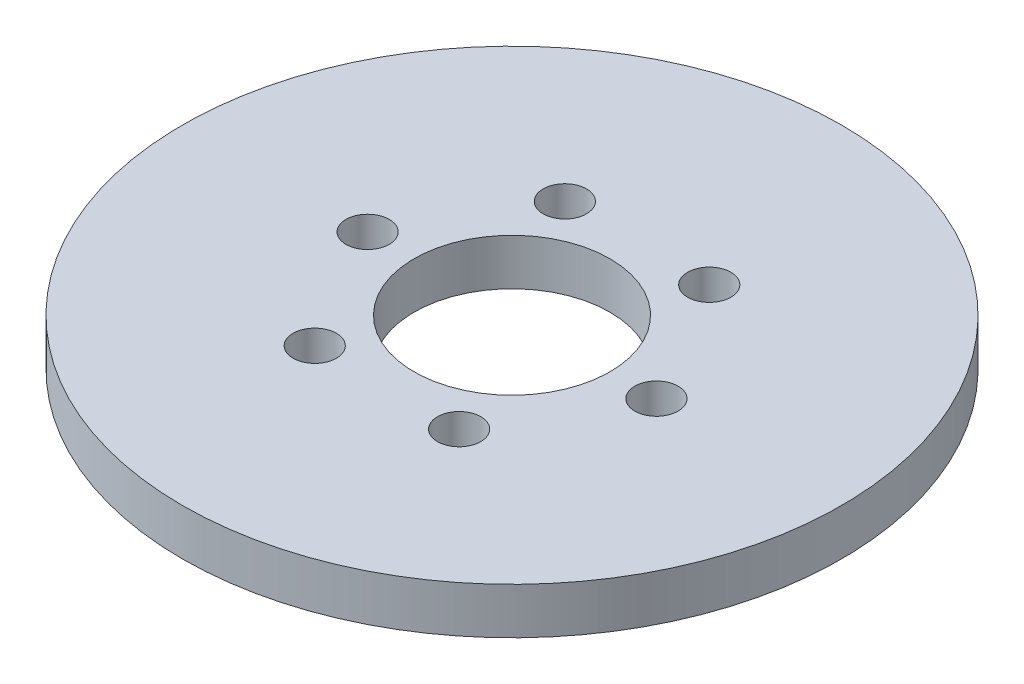
from build123d import *

# Parameters (mm, degrees)
SKETCH1_R           = 92.5
BOSS_EXTRUDE1_DEPTH = 13
SKETCH2_R           = 27.5
CUT_EXTRUDE1_DEPTH  = 132.459119121
SKETCH3_R           = 6.076508431
CUT_EXTRUDE2_DEPTH  = 10.455778892
CIRPATTERN1_COUNT   = 6


with BuildPart() as part:
    # Sketch1 → Boss-Extrude1 (new body)
    with BuildSketch(Plane(origin=(0, 0, 0), x_dir=(1, 0, 0), z_dir=(0, 1, 0))):
        Circle(SKETCH1_R)
    extrude(amount=BOSS_EXTRUDE1_DEPTH)

    # Sketch2 → Cut-Extrude1 (cut, through all)
    with BuildSketch(Plane(origin=(0, 0, 0), x_dir=(1, 0, 0), z_dir=(0, 1, 0))):
        Circle(SKETCH2_R)
    extrude(amount=CUT_EXTRUDE1_DEPTH, mode=Mode.SUBTRACT)

    # Sketch3 → Cut-Extrude2 (cut)
    with BuildSketch(Plane(origin=(0, 13, 0), x_dir=(1, 0, 0), z_dir=(0, 1, 0))):
        with Locations((-40.531362266, 0)):
            Circle(SKETCH3_R)
    cut_extrude2 = extrude(amount=-CUT_EXTRUDE2_DEPTH, mode=Mode.SUBTRACT)

    # CirPattern1: Cut-Extrude2 ×6 about axis
    cirpattern1_axis = Axis((0, 0, 0), (0, 1, 0))
    for i in range(1, CIRPATTERN1_COUNT):
        add(cut_extrude2.rotate(cirpattern1_axis, i * 360 / CIRPATTERN1_COUNT), mode=Mode.SUBTRACT)


solid = part.part
